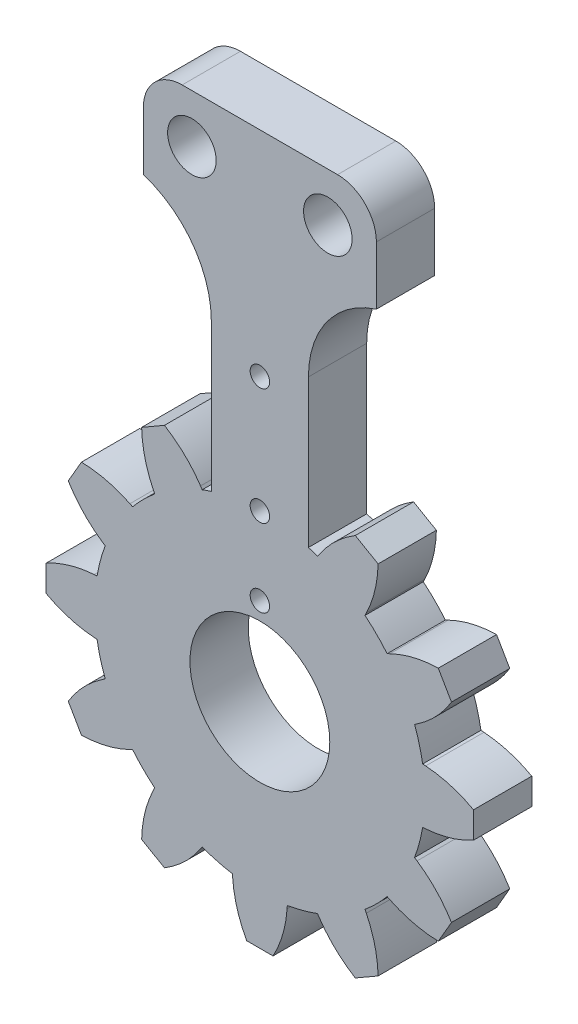
from build123d import *

# Parameters (mm, degrees)
SKETCH1_R           = 8.5
BOSS_EXTRUDE1_DEPTH = 3
BOSS_EXTRUDE2_DEPTH = 3
CIRPATTERN2_COUNT   = 12
FILLET5_R           = 6
FILLET6_R           = 6
BOSS_EXTRUDE3_DEPTH = 3
FILLET9_R           = 2.5
SKETCH20_R          = 3.6
CUT_EXTRUDE11_DEPTH = 10
SKETCH21_R          = 0.5
CUT_EXTRUDE12_DEPTH = 10
BOSS_EXTRUDE4_DEPTH = 3
SKETCH23_R          = 1.25
CUT_EXTRUDE13_DEPTH = 3
FILLET10_R          = 5
FILLET11_R          = 2


# Some blends are built 0.0001 mm under size
with BuildPart() as part:
    # Sketch1 → Boss-Extrude1 (new body)
    with BuildSketch(Plane.XY):
        Circle(SKETCH1_R)
    extrude(amount=BOSS_EXTRUDE1_DEPTH)

    # Sketch3 → Boss-Extrude2 (add)
    with BuildSketch(Plane.XY.offset(3)):
        Polygon((-1.305261922, 9.914448614), (-1.509060022, 7), (1.509060022, 7), (1.305261922, 9.914448614), (0.678518537, 11), (-0.678518537, 11), align=None)
    boss_extrude2 = extrude(amount=-BOSS_EXTRUDE2_DEPTH)

    # CirPattern2: Boss-Extrude2 ×12 about axis
    cirpattern2_axis = Axis((0, 0, 0), (0, 0, 1))
    for i in range(1, CIRPATTERN2_COUNT):
        add(boss_extrude2.rotate(cirpattern2_axis, i * 360 / CIRPATTERN2_COUNT))

    # Fillet5
    # the kernel refuses this fillet: 6 mm, written as the material it takes off along each edge
    with BuildSketch(Plane(origin=(9.238795325, 3.826834324, 6.454382408), x_dir=(0.4999999999998129, 0.8660254037845467, 0), z_dir=(0, 0, -1)), Plane(origin=(1.305261922, 9.914448614, 6.454382408), x_dir=(-0.5000000000001841, 0.8660254037843323, 0), z_dir=(0, 0, -1)), Plane(origin=(-7.933533403, 6.08761429, 6.454382408), x_dir=(-1, 0, 0), z_dir=(0, 0, -1)), Plane(origin=(-9.914448614, 1.305261922, 6.454382408), x_dir=(-0.8660254037843317, -0.5000000000001852, 0), z_dir=(0, 0, -1)), Plane(origin=(-9.238795325, -3.826834324, 6.454382408), x_dir=(-0.49999999999981826, -0.8660254037845436, 0), z_dir=(0, 0, -1)), Plane(origin=(-6.08761429, -7.933533403, 6.454382408), x_dir=(0, -1, 0), z_dir=(0, 0, -1)), Plane(origin=(3.826834324, -9.238795325, 6.454382408), x_dir=(0.866025403784545, -0.49999999999981576, 0), z_dir=(0, 0, -1)), Plane(origin=(7.933533403, -6.08761429, 6.454382408), x_dir=(1, 0, 0), z_dir=(0, 0, -1)), Plane(origin=(9.914448614, -1.305261922, 6.454382408), x_dir=(0.8660254037843321, 0.5000000000001844, 0), z_dir=(0, 0, -1))) as fillet5_piece_1:
        with BuildLine():
            CenterArc((1.388315544, -5.998484909), FILLET5_R, 91.287628333, 24.712371667)
            Line((-1.241911337, -0.605720631), (-1.294515874, -0.497865346))
            Line((-1.294515874, -0.497865346), (-0.052604538, 0.107855286))
            Line((-0.052604538, 0.107855286), (0, 0.12))
            ThreePointArc((0, 0.12), (0.626743385, 0.12), (1.250790195, 0.119969698))
            Line((1.250790195, 0.119969698), (1.25348677, 0))
        make_face()
    extrude(amount=9.908764816, mode=Mode.SUBTRACT)
    with BuildSketch(Plane(origin=(6.08761429, 7.933533403, 6.454382408), x_dir=(-0.4383711467890806, -0.8987940462991654, 0), z_dir=(0, 0, -1)), Plane(origin=(-3.826834324, 9.238795325, 6.454382408), x_dir=(0.5591929034707435, -0.8290375725550441, 0), z_dir=(0, 0, -1)), Plane(origin=(-1.305261922, -9.914448614, 6.454382408), x_dir=(-0.06975647374412178, 0.9975640502598244, 0), z_dir=(0, 0, -1))) as fillet5_piece_2:
        with BuildLine():
            CenterArc((1.381752963, 6), FILLET5_R, 245.287628333, 24.712371667)
            Line((-1.126626446, 0.549492433), (-1.176794034, 0.440482282))
            ThreePointArc((-1.176794034, 0.440482282), (-0.615917761, 0.166890931), (-0.052604538, -0.107855286))
            Line((-0.052604538, -0.107855286), (0, -0.12))
            Line((0, -0.12), (1.381752963, -0.12))
            Line((1.381752963, -0.12), (1.381752963, 0))
        make_face()
    extrude(amount=9.908764816, mode=Mode.SUBTRACT)

    # Fillet6
    # the kernel refuses this fillet: 6 mm, written as the material it takes off along each edge
    with BuildSketch(Plane(origin=(7.933533403, 6.08761429, 6.454382408), x_dir=(-0.8987940462991681, -0.4383711467890748, 0), z_dir=(0, 0, -1)), Plane(origin=(3.826834324, 9.238795325, 6.454382408), x_dir=(-0.5591929034707512, -0.8290375725550386, 0), z_dir=(0, 0, -1)), Plane(origin=(-1.305261922, 9.914448614, 6.454382408), x_dir=(-0.06975647374412959, -0.9975640502598239, 0), z_dir=(0, 0, -1)), Plane(origin=(-6.08761429, 7.933533403, 6.454382408), x_dir=(0.43837114678907496, -0.8987940462991681, 0), z_dir=(0, 0, -1)), Plane(origin=(-9.238795325, 3.826834324, 6.454382408), x_dir=(0.8290375725550394, -0.5591929034707502, 0), z_dir=(0, 0, -1)), Plane(origin=(-9.914448614, -1.305261922, 6.454382408), x_dir=(0.9975640502598241, -0.06975647374412908, 0), z_dir=(0, 0, -1)), Plane(origin=(-7.933533403, -6.08761429, 6.454382408), x_dir=(0.8987940462991686, 0.4383711467890744, 0), z_dir=(0, 0, -1)), Plane(origin=(-3.826834324, -9.238795325, 6.454382408), x_dir=(0.559192903470749, 0.8290375725550401, 0), z_dir=(0, 0, -1)), Plane(origin=(1.305261922, -9.914448614, 6.454382408), x_dir=(0.06975647374412973, 0.9975640502598241, 0), z_dir=(0, 0, -1)), Plane(origin=(6.08761429, -7.933533403, 6.454382408), x_dir=(-0.4383711467890742, 0.8987940462991686, 0), z_dir=(0, 0, -1)), Plane(origin=(9.238795325, -3.826834324, 6.454382408), x_dir=(-0.8290375725550386, 0.5591929034707512, 0), z_dir=(0, 0, -1)), Plane(origin=(9.914448614, 1.305261922, 6.454382408), x_dir=(-0.9975640502598239, 0.06975647374412945, 0), z_dir=(0, 0, -1))) as fillet6_piece_1:
        with BuildLine():
            CenterArc((1.381752963, -6), FILLET6_R, 90, 24.712371667)
            Line((-1.126626446, -0.549492433), (-1.176794034, -0.440482282))
            ThreePointArc((-1.176794034, -0.440482282), (-0.615917761, -0.166890931), (-0.052604538, 0.107855286))
            Line((-0.052604538, 0.107855286), (0, 0.12))
            Line((0, 0.12), (1.381752963, 0.12))
            Line((1.381752963, 0.12), (1.381752963, 0))
        make_face()
    extrude(amount=9.908764816, mode=Mode.SUBTRACT)

    # Sketch4 → Boss-Extrude3 (add)
    with BuildSketch(Plane(origin=(0, 0, 0), x_dir=(-1, 0, 0), z_dir=(0, 0, -1))):
        with BuildLine():
            Line((-2.5, 25.5), (-2.5, 4.330127019))
            ThreePointArc((-2.5, 4.330127019), (-5, 0), (-2.5, -4.330127019))
            Line((-2.5, -4.330127019), (-2.5, -7))
            Line((-2.5, -7), (2.5, -7))
            Line((2.5, -7), (2.5, -4.330127019))
            ThreePointArc((2.5, -4.330127019), (5, 0), (2.5, 4.330127019))
            Line((2.5, 4.330127019), (2.5, 25.5))
            Line((2.5, 25.5), (-2.5, 25.5))
        make_face()
    extrude(amount=-BOSS_EXTRUDE3_DEPTH)

    # Fillet9
    fillet9_edges = [part.edges().sort_by_distance(p)[0] for p in [
        (-2.5, 25.5, 1.5),
        (2.5, 25.5, 1.5),
    ]]
    fillet(fillet9_edges, radius=FILLET9_R - 0.0001)  # a hair under: the kernel refuses the full size

    # Sketch20 → Cut-Extrude11 (cut)
    with BuildSketch(Plane.XY.offset(3)):
        Circle(SKETCH20_R)
    extrude(amount=-CUT_EXTRUDE11_DEPTH, mode=Mode.SUBTRACT)

    # Sketch21 → Cut-Extrude12 (cut)
    with BuildSketch(Plane.XY.offset(3)):
        with Locations((0, 14.5)):
            Circle(SKETCH21_R)
        with Locations((0, 4.5)):
            Circle(SKETCH21_R)
        with Locations((0, 8.5)):
            Circle(SKETCH21_R)
    extrude(amount=-CUT_EXTRUDE12_DEPTH, mode=Mode.SUBTRACT)

    # Sketch22 → Boss-Extrude4 (add)
    with BuildSketch(Plane.XY.offset(3)):
        Polygon((0, 25.5), (6, 25.5), (6, 20.5), (-6, 20.5), (-6, 25.5), align=None)
    extrude(amount=-BOSS_EXTRUDE4_DEPTH)

    # Sketch23 → Cut-Extrude13 (cut)
    with BuildSketch(Plane.XY.offset(3)):
        with Locations((-3.5, 23)):
            Circle(SKETCH23_R)
        with Locations((3.5, 23)):
            Circle(SKETCH23_R)
    extrude(amount=-CUT_EXTRUDE13_DEPTH, mode=Mode.SUBTRACT)

    # Fillet10
    # the kernel refuses this fillet: 5 mm, written as the material it adds along each edge
    with BuildSketch(Plane(origin=(2.5, 20.5, 0), x_dir=(1, 0, 0), z_dir=(0, 0, 1))) as fillet10_piece_1:
        with BuildLine():
            CenterArc((5, -4.769696007), FILLET10_R, 107.457603124, 72.542396876)
            Line((0, -4.769696007), (-0.1, -4.769696007))
            Line((-0.1, -4.769696007), (-0.1, 0))
            Line((-0.1, 0), (0, 0.1))
            ThreePointArc((0, 0.1), (1.75, 0.1), (3.47, 0.09539392))
            Line((3.47, 0.09539392), (3.5, 0))
        make_face()
    extrude(amount=3)
    with BuildSketch(Plane(origin=(-2.5, 20.5, 3), x_dir=(0, -1, 0), z_dir=(0, 0, -1))) as fillet10_piece_2:
        with BuildLine():
            CenterArc((4.769696007, 5), FILLET10_R, 197.457603124, 72.542396876)
            Line((0, 3.5), (-0.09539392, 3.47))
            ThreePointArc((-0.09539392, 3.47), (-0.1, 1.75), (-0.1, 0))
            Line((-0.1, 0), (0, -0.1))
            Line((0, -0.1), (4.769696007, -0.1))
            Line((4.769696007, -0.1), (4.769696007, 0))
        make_face()
    extrude(amount=3)

    # Fillet11
    fillet11_edges = [part.edges().sort_by_distance(p)[0] for p in [
        (-6, 25.5, 1.5),
        (6, 25.5, 1.5),
    ]]
    fillet(fillet11_edges, radius=FILLET11_R)


solid = part.part
